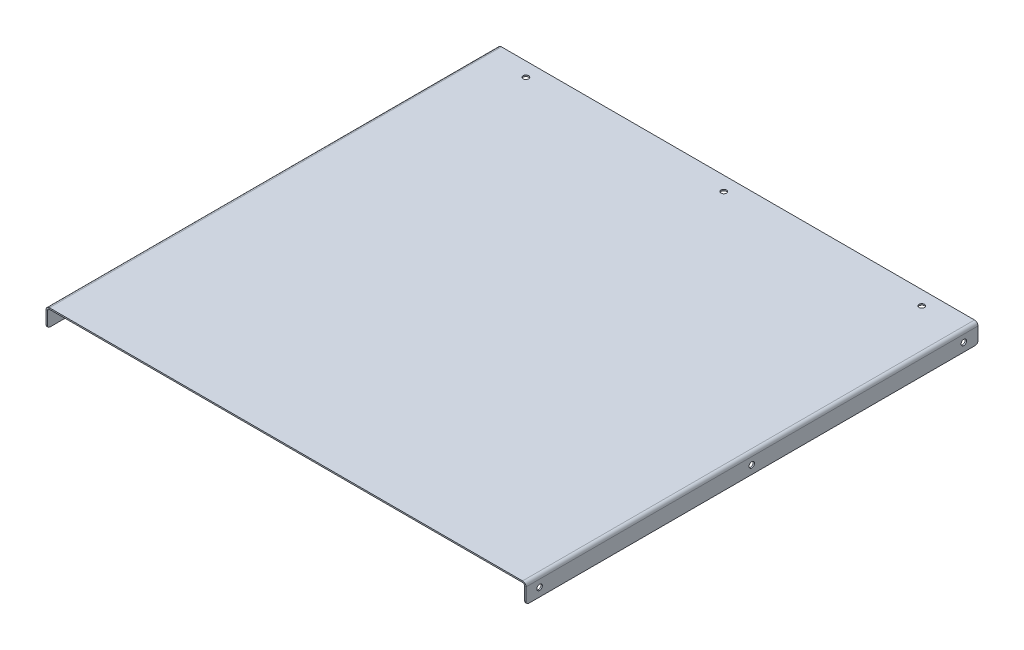
from build123d import *

# Parameters (mm, degrees)
BASE_FLANGE1_DEPTH = 405.892
FILLET1_R          = 2.54
SKETCH3_R          = 2.4765
CUT_EXTRUDE1_DEPTH = 593.315696883
SKETCH4_R          = 2.4765
CUT_EXTRUDE2_DEPTH = 1.2192


# Sheet-metal steps are written as plain solids
with BuildPart() as part:
    # Sketch1 → Base-Flange1 (new body)
    with BuildSketch(Plane.XY):
        with BuildLine():
            Line((-214.3252, -15.875), (-214.3252, -1.905))
            ThreePointArc((-214.3252, -1.905), (-213.767238418, -0.557961582), (-212.4202, 0))
            Line((-212.4202, 0), (212.4202, 0))
            ThreePointArc((212.4202, 0), (213.767238418, -0.557961582), (214.3252, -1.905))
            Line((214.3252, -1.905), (214.3252, -15.875))
            Line((214.3252, -15.875), (215.5444, -15.875))
            Line((215.5444, -15.875), (215.5444, -1.905))
            ThreePointArc((215.5444, -1.905), (214.629343006, 0.304143006), (212.4202, 1.2192))
            Line((212.4202, 1.2192), (-212.4202, 1.2192))
            ThreePointArc((-212.4202, 1.2192), (-214.629343006, 0.304143006), (-215.5444, -1.905))
            Line((-215.5444, -1.905), (-215.5444, -15.875))
            Line((-215.5444, -15.875), (-214.3252, -15.875))
        make_face()
    extrude(amount=BASE_FLANGE1_DEPTH)

    # Fillet1
    fillet1_edges = [part.edges().sort_by_distance(p)[0] for p in [
        (214.9348, -15.875, 0),
        (214.9348, -15.875, 405.892),
        (-214.9348, -15.875, 405.892),
        (-214.9348, -15.875, 0),
    ]]
    fillet(fillet1_edges, radius=FILLET1_R)

    # Sketch3 → Cut-Extrude1 (cut, through all)
    with BuildSketch(Plane(origin=(215.5444, 0, 0), x_dir=(0, 0, -1), z_dir=(1, 0, 0))):
        with Locations((-393.7, -8.305800148)):
            Circle(SKETCH3_R)
        with Locations((-203.2, -8.305800148)):
            Circle(SKETCH3_R)
        with Locations((-12.7, -8.305800148)):
            Circle(SKETCH3_R)
    extrude(amount=-CUT_EXTRUDE1_DEPTH, mode=Mode.SUBTRACT)

    # Sketch4 → Cut-Extrude2 (cut)
    with BuildSketch(Plane(origin=(0, 1.2192, 0), x_dir=(1, 0, 0), z_dir=(0, 1, 0))):
        with Locations(Location((-177.8, -12.7, 0), (0, 0, 180))):
            Circle(SKETCH4_R)
        with Locations(Location((0, -12.7, 0), (0, 0, 180))):
            Circle(SKETCH4_R)
        with Locations(Location((177.8, -12.7, 0), (0, 0, 180))):
            Circle(SKETCH4_R)
    extrude(amount=-CUT_EXTRUDE2_DEPTH, mode=Mode.SUBTRACT)


solid = part.part
